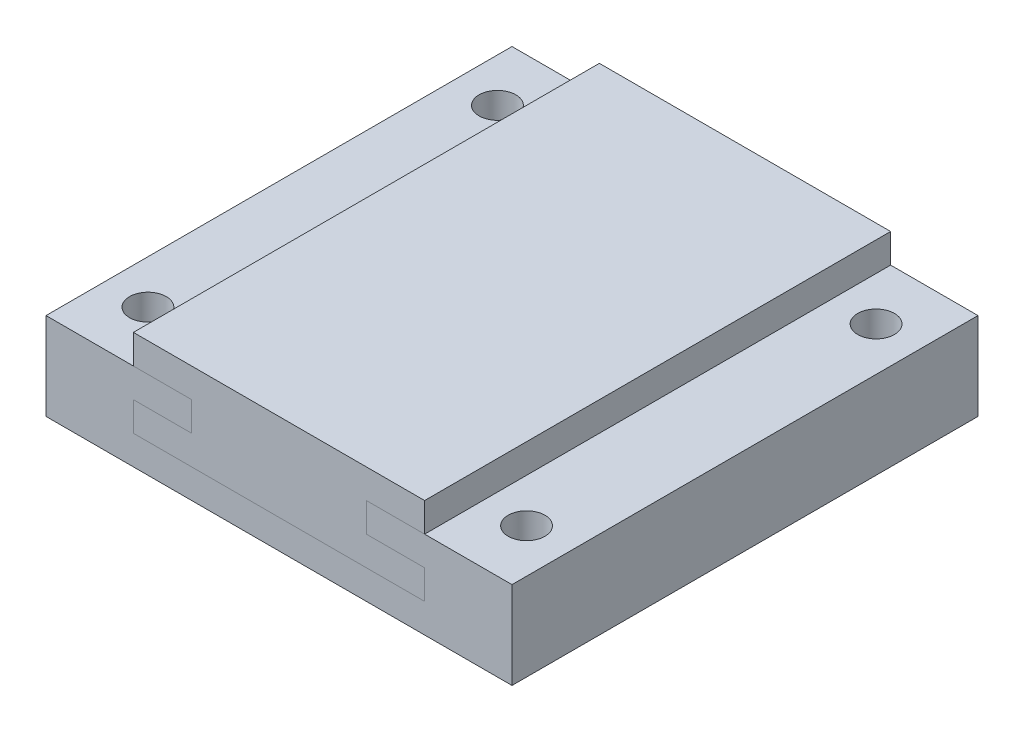
from build123d import *

# Parameters (mm, degrees)
SKETCH1_W              = 50.8
SKETCH1_H              = 50.8
BOSS_EXTRUDE1_DEPTH    = 3.175
BOSS_EXTRUDE5_DEPTH    = 6.35
CUT_EXTRUDE1_DEPTH     = 37.061067996
BOSS_EXTRUDE2_DEPTH    = 50.8
BOSS_EXTRUDE6_REACH    = 39.162
SKETCH10_W             = 50.8
SKETCH10_H             = 9.525
SKETCH12_R             = 2
CUT_EXTRUDE2_DEPTH     = 38.162422242
SKETCH15_W             = 31.75
SKETCH15_H             = 41.275
BOSS_EXTRUDE8_DEPTH    = 6.35
SKETCH16_W             = 31.75
SKETCH16_H             = 50.8
BOSS_EXTRUDE9_DEPTH    = 3.175
INTERSECT4_START       = -15.875
INTERSECT4_OUTLINE_W   = 3.175
INTERSECT4_OUTLINE_H   = 50.8
INTERSECT4_DEPTH       = 31.75
INTERSECT4_START_2     = -9.525
INTERSECT4_2_OUTLINE_W = 3.175
INTERSECT4_2_OUTLINE_H = 41.275
INTERSECT4_2_DEPTH     = 19.05
INTERSECT4_3_DEPTH     = 9.525
INTERSECT4_START_3     = 6.35
INTERSECT4_4_DEPTH     = 9.525
INTERSECT4_5_OUTLINE_R = 2
INTERSECT4_5_DEPTH     = 9.525
INTERSECT4_6_OUTLINE_W = 31.75
INTERSECT4_6_OUTLINE_H = 41.275
INTERSECT4_6_DEPTH     = 3.175


with BuildPart() as part:
    # Sketch1 → Boss-Extrude1 (new body)
    with BuildSketch(Plane(origin=(0, 0, 0), x_dir=(1, 0, 0), z_dir=(0, 1, 0))):
        Rectangle(SKETCH1_W, SKETCH1_H)
    extrude(amount=BOSS_EXTRUDE1_DEPTH)

    # Sketch7 → Boss-Extrude5 (add, symmetric)
    with BuildSketch(Plane(origin=(0, 0, 0), x_dir=(0, 0, -1), z_dir=(1, 0, 0))):
        with BuildLine():
            Line((-16.276050722, 3.175), (-9.123949278, 3.175))
            add(Edge.make_bspline(
                [(-16.276050722, 3.175), (-13.736050722, 3.175), (-12.7, 6.35), (-11.663949278, 3.175), (-9.123949278, 3.175)],
                knots=[0, 0, 0, 0, 0, 1, 1, 1, 1, 1], degree=4))
        make_face()
    extrude(amount=BOSS_EXTRUDE5_DEPTH, both=True)

    # Sketch8 → Cut-Extrude1 (cut, through all)
    with BuildSketch(Plane(origin=(0, 3.175, 0), x_dir=(1, 0, 0), z_dir=(0, 1, 0))):
        Polygon((-6.35, -16.276050722), (-6.35, -9.123949278), (-6.35, 9.926050722), (-7.35, 9.926050722), (-7.35, -9.123949278), (-7.35, -17.276050722), (7.35, -17.276050722), (7.35, -9.123949278), (7.35, 9.926050722), (6.35, 9.926050722), (6.35, -9.123949278), (6.35, -16.276050722), align=None)
    extrude(amount=-CUT_EXTRUDE1_DEPTH, mode=Mode.SUBTRACT)

    # Sketch3 → Boss-Extrude2 (add)
    with BuildSketch(Plane.XY.offset(25.4)):
        Polygon((-15.875, 3.175), (-25.4, 3.175), (-25.4, 9.525), (-9.525, 9.525), (-9.525, 6.35), (-15.875, 6.35), align=None)
        Polygon((9.525, 6.35), (15.875, 6.35), (15.875, 3.175), (25.4, 3.175), (25.4, 9.525), (9.525, 9.525), align=None)
    extrude(amount=-BOSS_EXTRUDE2_DEPTH)

    # Boss-Extrude6: up to this face of the body (flat: up to its plane)
    boss_extrude6_end = Plane(part.part.faces().sort_by_distance((0, 3.175, -1.076695791))[0])
    # Sketch10 → Boss-Extrude6 (add, up to the picked face)
    with BuildSketch(Plane(origin=(0, 9.525, 0), x_dir=(1, 0, 0), z_dir=(0, 1, 0)), mode=Mode.PRIVATE) as boss_extrude6_sk1:
        with Locations((0, 20.6375)):
            Rectangle(SKETCH10_W, SKETCH10_H)
    boss_extrude6_tool1 = split(extrude(boss_extrude6_sk1.sketch, amount=-BOSS_EXTRUDE6_REACH, mode=Mode.PRIVATE), bisect_by=boss_extrude6_end, keep=Keep.BOTH, mode=Mode.PRIVATE)
    add(boss_extrude6_tool1.solids().sort_by(Axis((0, 9.525, -20.6375), (0, -1, 0)))[0])

    # Sketch12 → Cut-Extrude2 (cut, through all)
    with BuildSketch(Plane(origin=(0, 9.525, 0), x_dir=(1, 0, 0), z_dir=(0, 1, 0))):
        with Locations(Location((-20.6375, -19.05, 0), (0, 0, 270))):
            Circle(SKETCH12_R)
        with Locations(Location((20.6375, -19.05, 0), (0, 0, 90))):
            Circle(SKETCH12_R)
        with Locations(Location((20.6375, 19.05, 0), (0, 0, 270))):
            Circle(SKETCH12_R)
        with Locations(Location((-20.6375, 19.05, 0), (0, 0, 90))):
            Circle(SKETCH12_R)
    extrude(amount=-CUT_EXTRUDE2_DEPTH, mode=Mode.SUBTRACT)


with BuildPart() as body_2:
    # Sketch15 → Boss-Extrude8 (new body)
    with BuildSketch(Plane(origin=(0, 3.175, 0), x_dir=(1, 0, 0), z_dir=(0, 1, 0))):
        with Locations((0, -4.7625)):
            Rectangle(SKETCH15_W, SKETCH15_H)
    extrude(amount=BOSS_EXTRUDE8_DEPTH)

    # Sketch16 → Boss-Extrude9 (add)
    with BuildSketch(Plane(origin=(0, 9.525, 0), x_dir=(1, 0, 0), z_dir=(0, 1, 0))):
        Rectangle(SKETCH16_W, SKETCH16_H)
    extrude(amount=BOSS_EXTRUDE9_DEPTH)


with BuildPart() as body_3:
    # Intersect4: read off the stored shape, not the designer's step
    # Intersect4 outline → Intersect4 (new body)
    with BuildSketch(Plane.YZ.offset(INTERSECT4_START)):
        with BuildLine():
            add(Edge.make_bspline(
                [(3.175, 9.123949278), (3.175, 11.663949278), (6.35, 12.7), (3.175, 13.736050722), (3.175, 16.276050722)],
                knots=[0, 0, 0, 0, 0, 1, 1, 1, 1, 1], degree=4))
            Line((3.175, 9.123949278), (3.175, -15.875))
            Line((3.175, -15.875), (6.35, -15.875))
            Line((6.35, -15.875), (6.35, 25.4))
            Line((6.35, 25.4), (3.175, 25.4))
            Line((3.175, 25.4), (3.175, 16.276050722))
        make_face()
        with Locations((11.1125, 0)):
            Rectangle(INTERSECT4_OUTLINE_W, INTERSECT4_OUTLINE_H)
    extrude(amount=INTERSECT4_DEPTH)

    # Intersect4 2 outline → Intersect4 2 (add)
    with BuildSketch(Plane.YZ.offset(INTERSECT4_START_2)):
        with Locations((7.9375, 4.7625)):
            Rectangle(INTERSECT4_2_OUTLINE_W, INTERSECT4_2_OUTLINE_H)
    extrude(amount=INTERSECT4_2_DEPTH)

    # Intersect4 3 outline → Intersect4 3 (add)
    with BuildSketch(Plane.YZ.offset(INTERSECT4_START)):
        with BuildLine():
            Line((3.175, 16.276050722), (3.175, 9.123949278))
            add(Edge.make_bspline(
                [(3.175, 9.123949278), (3.175, 11.663949278), (6.35, 12.7), (3.175, 13.736050722), (3.175, 16.276050722)],
                knots=[0, 0, 0, 0, 0, 1, 1, 1, 1, 1], degree=4))
        make_face()
    extrude(amount=INTERSECT4_3_DEPTH)

    # Intersect4 4 outline → Intersect4 4 (add)
    with BuildSketch(Plane.YZ.offset(INTERSECT4_START_3)):
        with BuildLine():
            Line((3.175, 16.276050722), (3.175, 9.123949278))
            add(Edge.make_bspline(
                [(3.175, 9.123949278), (3.175, 11.663949278), (6.35, 12.7), (3.175, 13.736050722), (3.175, 16.276050722)],
                knots=[0, 0, 0, 0, 0, 1, 1, 1, 1, 1], degree=4))
        make_face()
    extrude(amount=INTERSECT4_4_DEPTH)


with BuildPart() as body_4:
    # Intersect4 5 outline → Intersect4 5 (new body)
    with BuildSketch(Plane(origin=(0, 0, 0), x_dir=(1, 0, 0), z_dir=(0, 1, 0))):
        Polygon((-15.875, 15.875), (15.875, 15.875), (15.875, -25.4), (25.4, -25.4), (25.4, 25.4), (-25.4, 25.4), (-25.4, -25.4), (-15.875, -25.4), align=None)
        with Locations((-20.6375, -19.05)):
            Circle(INTERSECT4_5_OUTLINE_R, mode=Mode.SUBTRACT)
        with Locations((20.6375, -19.05)):
            Circle(INTERSECT4_5_OUTLINE_R, mode=Mode.SUBTRACT)
        with Locations((-20.6375, 19.05)):
            Circle(INTERSECT4_5_OUTLINE_R, mode=Mode.SUBTRACT)
        with Locations((20.6375, 19.05)):
            Circle(INTERSECT4_5_OUTLINE_R, mode=Mode.SUBTRACT)
    extrude(amount=INTERSECT4_5_DEPTH)

    # Intersect4 6 outline → Intersect4 6 (add)
    with BuildSketch(Plane(origin=(0, 0, 0), x_dir=(1, 0, 0), z_dir=(0, 1, 0))):
        with Locations((0, -4.7625)):
            Rectangle(INTERSECT4_6_OUTLINE_W, INTERSECT4_6_OUTLINE_H)
        Polygon((7.35, 9.926050722), (7.35, -17.276050722), (-7.35, -17.276050722), (-7.35, 9.926050722), (-6.35, 9.926050722), (-6.35, -16.276050722), (6.35, -16.276050722), (6.35, 9.926050722), align=None, mode=Mode.SUBTRACT)
    extrude(amount=INTERSECT4_6_DEPTH)


solid = Compound([part.part, body_3.part])
